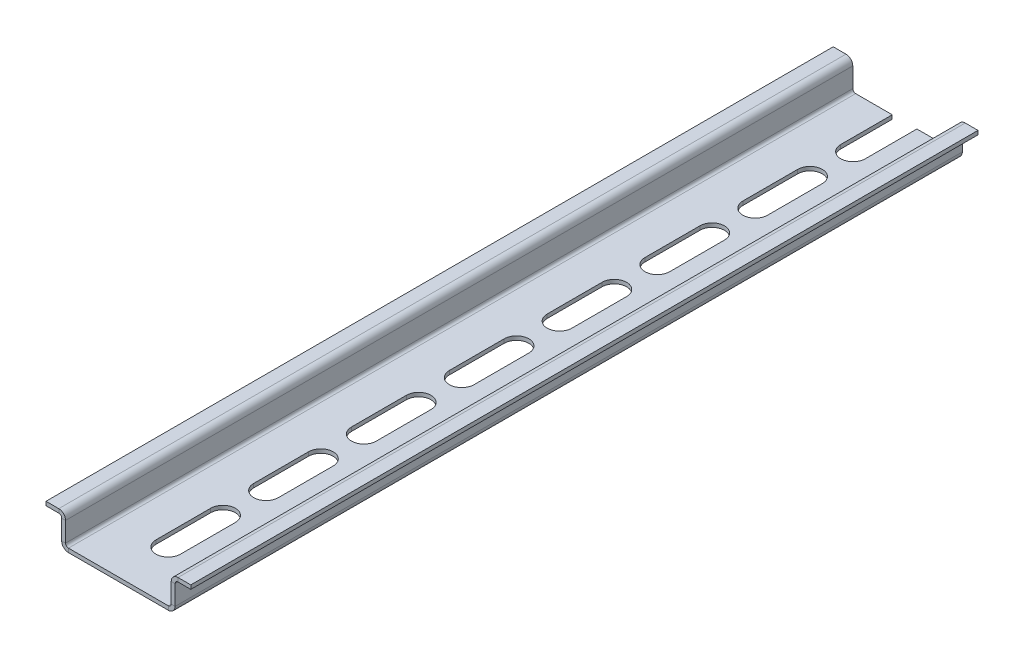
from build123d import *

# Parameters (mm, degrees)
BASE_FLANGE1_DEPTH = 201.168
CUT_EXTRUDE1_DEPTH = 10
LPATTERN1_COUNT    = 11
LPATTERN1_PITCH    = 25


# Sheet-metal steps are written as plain solids
with BuildPart() as part:
    # Sketch1 → Base-Flange1 (new body)
    with BuildSketch(Plane.XY):
        with BuildLine():
            Line((0, 0), (3.2634, 0))
            ThreePointArc((3.2634, 0), (4.491361636, -0.508638364), (5, -1.7366))
            Line((5, -1.7366), (5, -6.7634))
            ThreePointArc((5, -6.7634), (5.215745145, -7.284254855), (5.7366, -7.5))
            Line((5.7366, -7.5), (31.2634, -7.5))
            ThreePointArc((31.2634, -7.5), (31.784254855, -7.284254855), (32, -6.7634))
            Line((32, -6.7634), (32, -1.7366))
            ThreePointArc((32, -1.7366), (32.508638364, -0.508638364), (33.7366, 0))
            Line((33.7366, 0), (37, 0))
            Line((37, 0), (37, -1))
            Line((37, -1), (33.7366, -1))
            ThreePointArc((33.7366, -1), (33.215745145, -1.215745145), (33, -1.7366))
            Line((33, -1.7366), (33, -6.7634))
            ThreePointArc((33, -6.7634), (32.491361636, -7.991361636), (31.2634, -8.5))
            Line((31.2634, -8.5), (5.7366, -8.5))
            ThreePointArc((5.7366, -8.5), (4.508638364, -7.991361636), (4, -6.7634))
            Line((4, -6.7634), (4, -1.7366))
            ThreePointArc((4, -1.7366), (3.784254855, -1.215745145), (3.2634, -1))
            Line((3.2634, -1), (0, -1))
            Line((0, -1), (0, 0))
        make_face()
    extrude(amount=BASE_FLANGE1_DEPTH)

    # Sketch6 → Cut-Extrude1 (cut)
    with BuildSketch(Plane(origin=(0, -7.5, 0), x_dir=(1, 0, 0), z_dir=(0, 1, 0))):
        with BuildLine():
            Line((21.3866, -174.168), (21.3866, -188.168))
            ThreePointArc((21.3866, -188.168), (18.2366, -191.318), (15.0866, -188.168))
            Line((15.0866, -188.168), (15.0866, -174.168))
            ThreePointArc((15.0866, -174.168), (18.2366, -171.018), (21.3866, -174.168))
        make_face()
    cut_extrude1 = extrude(amount=-CUT_EXTRUDE1_DEPTH, mode=Mode.SUBTRACT)

    # LPattern1: Cut-Extrude1 ×11
    with Locations(*[(0, 0, -i * LPATTERN1_PITCH) for i in range(1, LPATTERN1_COUNT)]):
        add(cut_extrude1, mode=Mode.SUBTRACT)


solid = part.part
